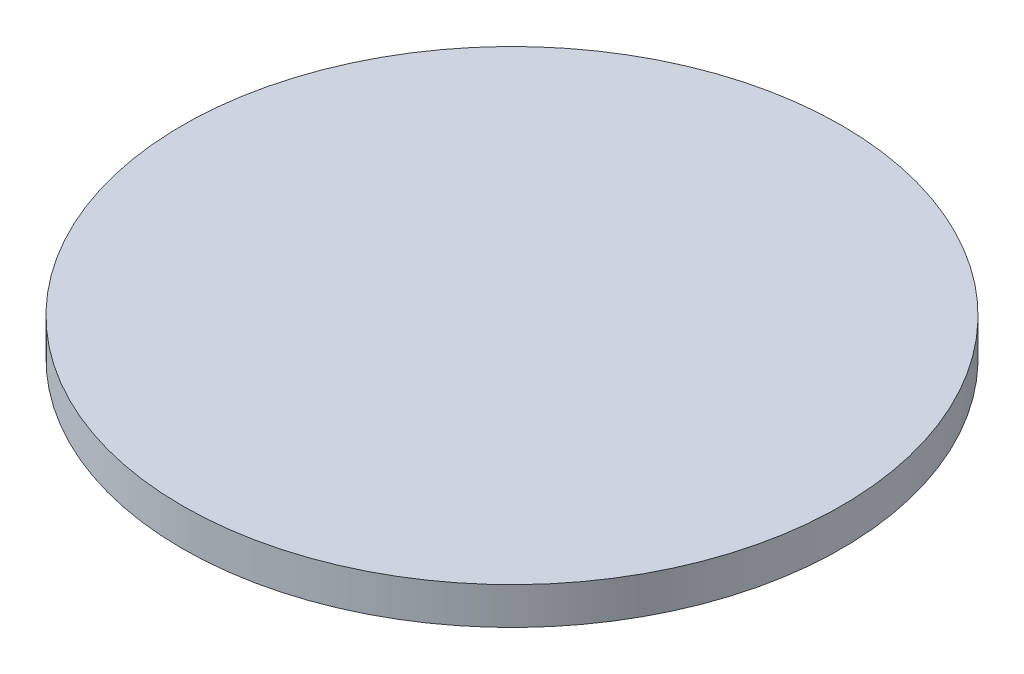
from build123d import *

# Parameters (mm, degrees)
SKETCH1_R           = 85.725
BOSS_EXTRUDE1_DEPTH = 4.826


with BuildPart() as part:
    # Sketch1 → Boss-Extrude1 (new, symmetric)
    with BuildSketch(Plane(origin=(0, 0, 0), x_dir=(1, 0, 0), z_dir=(0, 1, 0))):
        Circle(SKETCH1_R)
    extrude(amount=BOSS_EXTRUDE1_DEPTH, both=True)


solid = part.part
